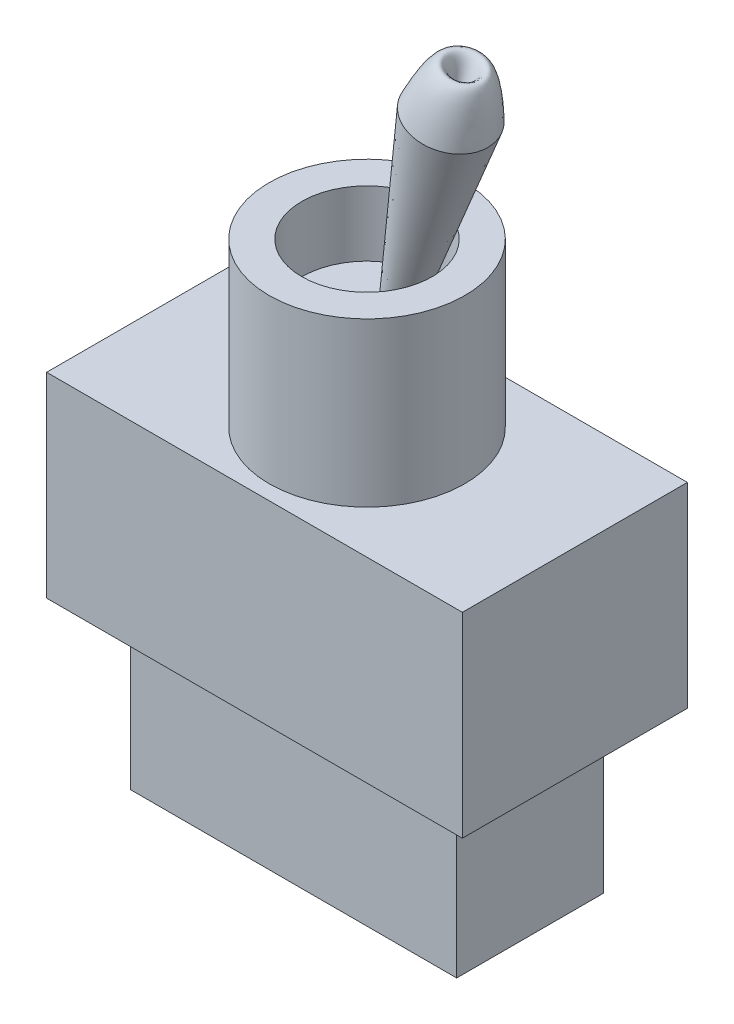
from build123d import *

# Parameters (mm, degrees)
SZKIC1_W                    = 25.5
SZKIC1_H                    = 13.8
DODANIE_WYCI_GNI_CIE1_DEPTH = 12
SZKIC2_R                    = 6
DODANIE_WYCI_GNI_CIE2_DEPTH = 10
SZKIC4_R                    = 4
WYTNIJ_WYCI_GNI_CIE1_DEPTH  = 4
SZKIC5_W                    = 20
SZKIC5_H                    = 9
DODANIE_WYCI_GNI_CIE3_DEPTH = 10


with BuildPart() as part:
    # Szkic1 → Dodanie-wyciągnięcie1 (new body)
    with BuildSketch(Plane(origin=(0, 0, 0), x_dir=(1, 0, 0), z_dir=(0, 1, 0))):
        Rectangle(SZKIC1_W, SZKIC1_H)
    extrude(amount=DODANIE_WYCI_GNI_CIE1_DEPTH)

    # Szkic2 → Dodanie-wyciągnięcie2 (add)
    with BuildSketch(Plane(origin=(0, 12, 0), x_dir=(1, 0, 0), z_dir=(0, 1, 0))):
        Circle(SZKIC2_R)
    extrude(amount=DODANIE_WYCI_GNI_CIE2_DEPTH)

    # Szkic4 → Wytnij-wyciągnięcie1 (cut)
    with BuildSketch(Plane(origin=(0, 22, 0), x_dir=(1, 0, 0), z_dir=(0, 1, 0))):
        Circle(SZKIC4_R)
    extrude(amount=-WYTNIJ_WYCI_GNI_CIE1_DEPTH, mode=Mode.SUBTRACT)

    # Szkic5 → Dodanie-wyciągnięcie3 (add)
    with BuildSketch(Plane.XZ):
        Rectangle(SZKIC5_W, SZKIC5_H)
    extrude(amount=DODANIE_WYCI_GNI_CIE3_DEPTH)


with BuildPart() as body_2:
    # Szkic3 → Obrót1 (revolve)
    with BuildSketch(Plane.XY):
        with BuildLine():
            Line((0, 12), (2.863719686, 31.793915973))
            add(Edge.make_bspline(
                [(5.176380902, 31.318516526), (5.508983316, 35.10659806), (4.841206983, 35.627283227), (2.863719686, 31.793915973)],
                knots=[0, 0, 0, 0, 1, 1, 1, 1], degree=3))
            Line((5.176380902, 31.318516526), (0, 12))
        make_face()
    revolve(axis=Axis((0, 12, 0), (0.25881904510251413, 0.9659258262890701, 0)))


solid = Compound([part.part, body_2.part])
